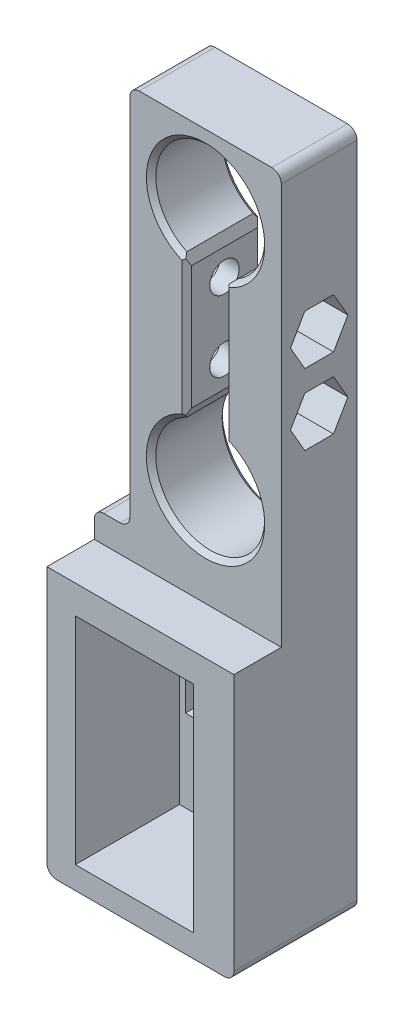
from build123d import *

# Parameters (mm, degrees)
SKETCH_1_R               = 11.5
SKETCH_1_W               = 25
SKETCH_1_H               = 45.5
EXTRUDE_1_DEPTH          = 16
SKETCH_2_R               = 3.1
CUT_EXTRUDE_1_DEPTH      = 120.143820654
SKETCH_2_2_R             = 5.6
SKETCH_2_2_R_2           = 3.1
CUT_EXTRUDE_1_2_DEPTH    = 8
CUT_EXTRUDE_2_DEPTH      = 108.64408948
CUT_EXTRUDE_2_DEPTH_BACK = 108.64408948
SKETCH_3_W               = 8
SKETCH_3_H               = 51
CUT_EXTRUDE_2_2_DEPTH    = 8
CHAMFER_1_SIZE           = 1.695682666
CHAMFER_1_SIZE_2         = 1
SKETCH_1_2_W             = 25
SKETCH_1_2_H             = 45.5
EXTRUDE_2_DEPTH          = 4
SKETCH_6_R               = 3.25
CUT_EXTRUDE_3_DEPTH      = 108.122593322
SKETCH_7_W               = 39.5
SKETCH_7_H               = 56.25
SKETCH_7_W_2             = 25
SKETCH_7_H_2             = 45.5
SKETCH_7_W_3             = 37
EXTRUDE_3_DEPTH          = 10
FILLET_1_R               = 2
CHAMFER_2_SIZE           = 1
CHAMFER_3_SIZE           = 25
CUT_EXTRUDE_4_DEPTH      = 108.64408948
CUT_EXTRUDE_4_DEPTH_BACK = 108.64408948
SKETCH_8_W               = 71.361850602
SKETCH_8_H               = 94.902741324
FILLET_2_R               = 2


with BuildPart() as part:
    # 草图1 → 凸台-拉伸1 (new body)
    with BuildSketch(Plane.XY):
        Polygon((16, 66), (-16, 66), (-16, -15), (-23.5, -15), (-23.5, -77), (13.5, -77), (73.5, -77), (73.5, -15), (16, -15), align=None)
        with Locations((0, 51)):
            Circle(SKETCH_1_R, mode=Mode.SUBTRACT)
        Circle(SKETCH_1_R, mode=Mode.SUBTRACT)
        with Locations((-5, -49.5)):
            Rectangle(SKETCH_1_W, SKETCH_1_H, mode=Mode.SUBTRACT)
        with Locations((55, -49.5)):
            Rectangle(SKETCH_1_W, SKETCH_1_H, mode=Mode.SUBTRACT)
    extrude(amount=EXTRUDE_1_DEPTH)

    # 草图2 → Cut-Extrude 1 (cut, through all)
    with BuildSketch(Plane.ZY.offset(16)):
        with Locations(Location((8, 33, 0), (0, 0, 270))):
            Circle(SKETCH_2_R)
        with Locations(Location((8, 18, 0), (0, 0, 270))):
            Circle(SKETCH_2_R)
    extrude(amount=-CUT_EXTRUDE_1_DEPTH, mode=Mode.SUBTRACT)

    # 草图2<2> → Cut-Extrude 1 2 (cut)
    # profile 1 of 2: a face of its own
    with BuildSketch(Plane.ZY.offset(16)):
        with Locations((8, 33)):
            Circle(SKETCH_2_2_R)
        with Locations((8, 33)):
            Circle(SKETCH_2_2_R_2, mode=Mode.SUBTRACT)
    # profile 2 of 2: a face of its own
    with BuildSketch(Plane.ZY.offset(16)):
        with Locations((8, 18)):
            Circle(SKETCH_2_2_R)
        with Locations((8, 18)):
            Circle(SKETCH_2_2_R_2, mode=Mode.SUBTRACT)
    extrude(amount=-CUT_EXTRUDE_1_2_DEPTH, mode=Mode.SUBTRACT)

    # 草图3 → Cut-Extrude 2 (cut, two sides: drawn at the far end of the back side and taken through both)
    with BuildSketch(Plane.XY.offset(16).offset(-CUT_EXTRUDE_2_DEPTH_BACK)):
        with Locations((0, 25.5)):
            Rectangle(SKETCH_3_W, SKETCH_3_H)
    extrude(amount=CUT_EXTRUDE_2_DEPTH + CUT_EXTRUDE_2_DEPTH_BACK, mode=Mode.SUBTRACT)

    # 草图4 → Cut-Extrude 2 2 (cut)
    with BuildSketch(Plane(origin=(16, 0, 0), x_dir=(0, 0, -1), z_dir=(1, 0, 0))):
        Polygon((-1.937822174, 33), (-4.968911087, 38.25), (-11.031088913, 38.25), (-14.062177826, 33), (-11.031088913, 27.75), (-4.968911087, 27.75), align=None)
        Polygon((-1.937822174, 18), (-4.968911087, 23.25), (-11.031088913, 23.25), (-14.062177826, 18), (-11.031088913, 12.75), (-4.968911087, 12.75), align=None)
    extrude(amount=-CUT_EXTRUDE_2_2_DEPTH, mode=Mode.SUBTRACT)

    # 倒角1
    # the kernel refuses this chamfer: 1.695682666, 1 mm, written as the material it takes off along each edge
    with BuildSketch(Plane(origin=(-4, 40.218070674, 20.393897044), x_dir=(0, -1, 0), z_dir=(0, 0, -1))) as chamfer_1_piece_1:
        with BuildLine():
            Line((CHAMFER_1_SIZE, 0), (-0.409315042, 0.965770122))
            ThreePointArc((-0.409315042, 0.965770122), (-0.203470382, 0.51067693), (0, 0))
            Line((0, 0), (CHAMFER_1_SIZE, 0))
        make_face()
    extrude(amount=24.787794087, mode=Mode.SUBTRACT)
    with BuildSketch(Plane(origin=(-4, 10.781929326, 20.393897044), x_dir=(0, 1, 0), z_dir=(0, 0, -1))) as chamfer_1_piece_2:
        with BuildLine():
            Line((CHAMFER_1_SIZE, 0), (-0.409315042, -0.965770122))
            ThreePointArc((-0.409315042, -0.965770122), (-0.203470382, -0.51067693), (0, 0))
            Line((0, 0), (CHAMFER_1_SIZE, 0))
        make_face()
    extrude(amount=24.787794087, mode=Mode.SUBTRACT)
    with BuildSketch(Plane(origin=(4, 40.218070674, 21.505815426), x_dir=(0.9011630930702207, 0.4334801952663038, 0), z_dir=(0, 0, -1))) as chamfer_1_piece_3:
        with BuildLine():
            Line((2.138200915, 0), (-CHAMFER_1_SIZE_2 * 0.433480195266, CHAMFER_1_SIZE_2 * 0.90116309307))
            Line((-CHAMFER_1_SIZE_2 * 0.433480195266, CHAMFER_1_SIZE_2 * 0.90116309307), (0, 0))
            ThreePointArc((0, 0), (1.101276568, 0.049757425), (2.138200915, 0))
        make_face()
    extrude(amount=27.011630851, mode=Mode.SUBTRACT)
    with BuildSketch(Plane(origin=(4, 10.781929326, 21.505815426), x_dir=(0, 1, 0), z_dir=(0, 0, -1))) as chamfer_1_piece_4:
        with BuildLine():
            Line((CHAMFER_1_SIZE_2, 0), (-0.92686775, 1.92686775))
            ThreePointArc((-0.92686775, 1.92686775), (-0.432542027, 1.013998656), (0, 0))
            Line((0, 0), (CHAMFER_1_SIZE_2, 0))
        make_face()
    extrude(amount=27.011630851, mode=Mode.SUBTRACT)

    # 草图1<2> → 凸台-拉伸2 (add)
    with BuildSketch(Plane.XY):
        with Locations((-5, -49.5)):
            Rectangle(SKETCH_1_2_W, SKETCH_1_2_H)
        with Locations((55, -49.5)):
            Rectangle(SKETCH_1_2_W, SKETCH_1_2_H)
    extrude(amount=EXTRUDE_2_DEPTH)

    # 草图6 → 切除-拉伸3 (cut, through all)
    with BuildSketch(Plane.XY.offset(4)):
        with Locations((-5, -37)):
            Circle(SKETCH_6_R)
        with Locations((55, -37)):
            Circle(SKETCH_6_R)
        Polygon((-16.25, -54.9), (-14.5, -54.9), (-14.5, -69.9), (4.5, -69.9), (4.5, -54.9), (6.25, -54.9), (6.25, -48.5), (-16.25, -48.5), align=None)
        Polygon((45.5, -54.9), (43.75, -54.9), (43.75, -48.5), (66.25, -48.5), (66.25, -54.9), (64.5, -54.9), (64.5, -69.9), (45.5, -69.9), align=None)
    extrude(amount=-CUT_EXTRUDE_3_DEPTH, mode=Mode.SUBTRACT)

    # 草图7 → 凸台-拉伸3 (add)
    # profile 1 of 2: a face of its own
    with BuildSketch(Plane.XY.offset(16)):
        with Locations((-3.75, -48.875)):
            Rectangle(SKETCH_7_W, SKETCH_7_H)
        with Locations((-5, -49.5)):
            Rectangle(SKETCH_7_W_2, SKETCH_7_H_2, mode=Mode.SUBTRACT)
    # profile 2 of 2: a face of its own
    with BuildSketch(Plane.XY.offset(16)):
        with Locations((55, -48.875)):
            Rectangle(SKETCH_7_W_3, SKETCH_7_H)
        with Locations((55, -49.5)):
            Rectangle(SKETCH_7_W_2, SKETCH_7_H_2, mode=Mode.SUBTRACT)
    extrude(amount=EXTRUDE_3_DEPTH)

    # 圆角1
    fillet_1_edges = [part.edges().sort_by_distance(p)[0] for p in [
        (-16, 66, 8),
        (16, 66, 8),
        (73.5, -15, 8),
        (73.5, -77, 13),
        (-23.5, -77, 13),
        (-23.5, -15, 8),
        (-16, -15, 8),
    ]]
    fillet(fillet_1_edges, radius=FILLET_1_R)

    # 倒角2
    # the kernel refuses this chamfer: 1 mm, written as the material it takes off along each edge
    with BuildSketch(Plane(origin=(-4, 9.905929004, 16), x_dir=(-1, 0, 0), z_dir=(0, 1, 0))) as chamfer_2_piece_1:
        Polygon((CHAMFER_2_SIZE, 0), (0, -CHAMFER_2_SIZE), (0, 0), align=None)
    extrude(amount=31.188141991, mode=Mode.SUBTRACT)
    with BuildSketch(Plane(origin=(-4, 9.905929004, 0), x_dir=(-1, 0, 0), z_dir=(0, 1, 0))) as chamfer_2_piece_2:
        Polygon((CHAMFER_2_SIZE, 0), (0, CHAMFER_2_SIZE), (0, 0), align=None)
    extrude(amount=31.188141991, mode=Mode.SUBTRACT)
    with BuildSketch(Plane(origin=(0, 0, 16), x_dir=(0.15887239859298968, 0.9872991243616649, 0), z_dir=(-0.9872991243616649, 0.15887239859298968, 0))) as chamfer_2_piece_3:
        Polygon((11.5 + CHAMFER_2_SIZE, 0), (11.5, CHAMFER_2_SIZE), (11.5, 0), align=None)
    revolve(axis=Axis((0, 0, 16), (0, 0, -1)), revolution_arc=338.147720881, mode=Mode.SUBTRACT)
    with BuildSketch(Plane(origin=(0, 0, 0), x_dir=(-0.22003054145636358, 0.9754929834839509, 0), z_dir=(0.9754929834839509, 0.22003054145636358, 0))) as chamfer_2_piece_4:
        Polygon((11.5 + CHAMFER_2_SIZE, 0), (11.5, CHAMFER_2_SIZE), (11.5, 0), align=None)
    revolve(axis=Axis((0, 0, 0), (0, 0, 1)), revolution_arc=338.147720881, mode=Mode.SUBTRACT)
    with BuildSketch(Plane(origin=(4, 41.789753662, 16), x_dir=(1, 0, 0), z_dir=(0, -1, 0))) as chamfer_2_piece_5:
        Polygon((CHAMFER_2_SIZE, 0), (0, -CHAMFER_2_SIZE), (0, 0), align=None)
    extrude(amount=32.579507323, mode=Mode.SUBTRACT)
    with BuildSketch(Plane(origin=(4, 41.789753662, 0), x_dir=(1, 0, 0), z_dir=(0, -1, 0))) as chamfer_2_piece_6:
        Polygon((CHAMFER_2_SIZE, 0), (0, CHAMFER_2_SIZE), (0, 0), align=None)
    extrude(amount=32.579507323, mode=Mode.SUBTRACT)
    with BuildSketch(Plane(origin=(0, 51, 0), x_dir=(0.15887239859295355, -0.9872991243616707, 0), z_dir=(-0.9872991243616707, -0.15887239859295355, 0))) as chamfer_2_piece_7:
        Polygon((11.5 + CHAMFER_2_SIZE, 0), (11.5, CHAMFER_2_SIZE), (11.5, 0), align=None)
    revolve(axis=Axis((0, 51, 0), (0, 0, 1)), revolution_arc=338.147720881, mode=Mode.SUBTRACT)
    with BuildSketch(Plane(origin=(0, 51, 16), x_dir=(-0.2200305414563642, -0.9754929834839506, 0), z_dir=(0.9754929834839506, -0.2200305414563642, 0))) as chamfer_2_piece_8:
        Polygon((11.5 + CHAMFER_2_SIZE, 0), (11.5, CHAMFER_2_SIZE), (11.5, 0), align=None)
    revolve(axis=Axis((0, 51, 16), (0, 0, -1)), revolution_arc=338.147720881, mode=Mode.SUBTRACT)

    # 倒角3
    chamfer_3_edges = [part.edges().sort_by_distance(p)[0] for p in [
        (16, -15, 8),
    ]]
    chamfer(chamfer_3_edges, length=CHAMFER_3_SIZE)

    # 草图8 → 切除-拉伸4 (cut, two sides: drawn at the far end of the back side and taken through both)
    with BuildSketch(Plane.XY.offset(16).offset(-CUT_EXTRUDE_4_DEPTH_BACK)):
        with Locations((51.680925301, -37.451370662)):
            Rectangle(SKETCH_8_W, SKETCH_8_H)
    extrude(amount=CUT_EXTRUDE_4_DEPTH + CUT_EXTRUDE_4_DEPTH_BACK, mode=Mode.SUBTRACT)

    # 圆角2
    fillet_2_edges = [part.edges().sort_by_distance(p)[0] for p in [
        (16, -77, 13),
    ]]
    fillet(fillet_2_edges, radius=FILLET_2_R)


solid = part.part
